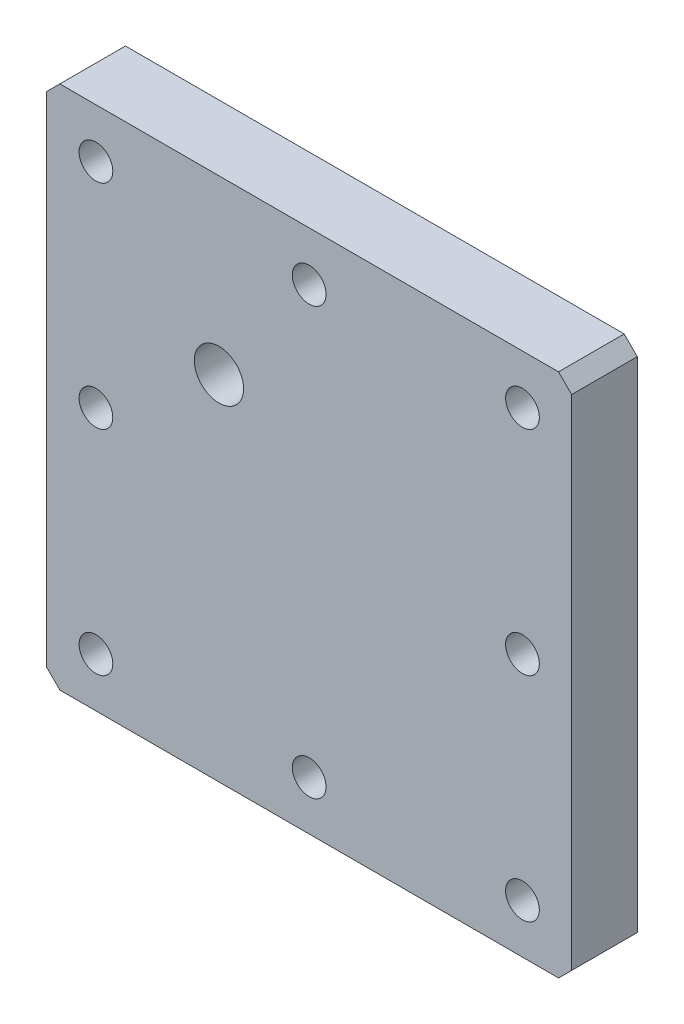
from build123d import *

# Parameters (mm, degrees)
SKETCH1_R           = 3.2639
BOSS_EXTRUDE1_DEPTH = 12.7


with BuildPart() as part:
    # Sketch1 → Boss-Extrude1 (new body)
    with BuildSketch(Plane.XY):
        Polygon((-48.26, 50.8), (-50.8, 48.26), (-50.8, -48.26), (-48.26, -50.8), (48.26, -50.8), (50.8, -48.26), (50.8, 48.26), (48.26, 50.8), align=None)
        with Locations((-41.275, -41.275)):
            Circle(SKETCH1_R, mode=Mode.SUBTRACT)
        with Locations((0, -41.275)):
            Circle(SKETCH1_R, mode=Mode.SUBTRACT)
        with Locations((-41.275, 0)):
            Circle(SKETCH1_R, mode=Mode.SUBTRACT)
        with Locations((41.275, -41.275)):
            Circle(SKETCH1_R, mode=Mode.SUBTRACT)
        with Locations((-41.275, 41.275)):
            Circle(SKETCH1_R, mode=Mode.SUBTRACT)
        with Locations((0, 41.275)):
            Circle(SKETCH1_R, mode=Mode.SUBTRACT)
        with Locations((41.275, 0)):
            Circle(SKETCH1_R, mode=Mode.SUBTRACT)
        with Locations((41.275, 41.275)):
            Circle(SKETCH1_R, mode=Mode.SUBTRACT)
        with BuildLine():
            ThreePointArc((-14.094903955, 14.094903955), (-20.830096045, 14.094903955), (-20.830096045, 20.830096045))
            ThreePointArc((-20.830096045, 20.830096045), (-14.094903955, 20.830096045), (-14.094903955, 14.094903955))
        make_face(mode=Mode.SUBTRACT)
    extrude(amount=BOSS_EXTRUDE1_DEPTH)


solid = part.part
